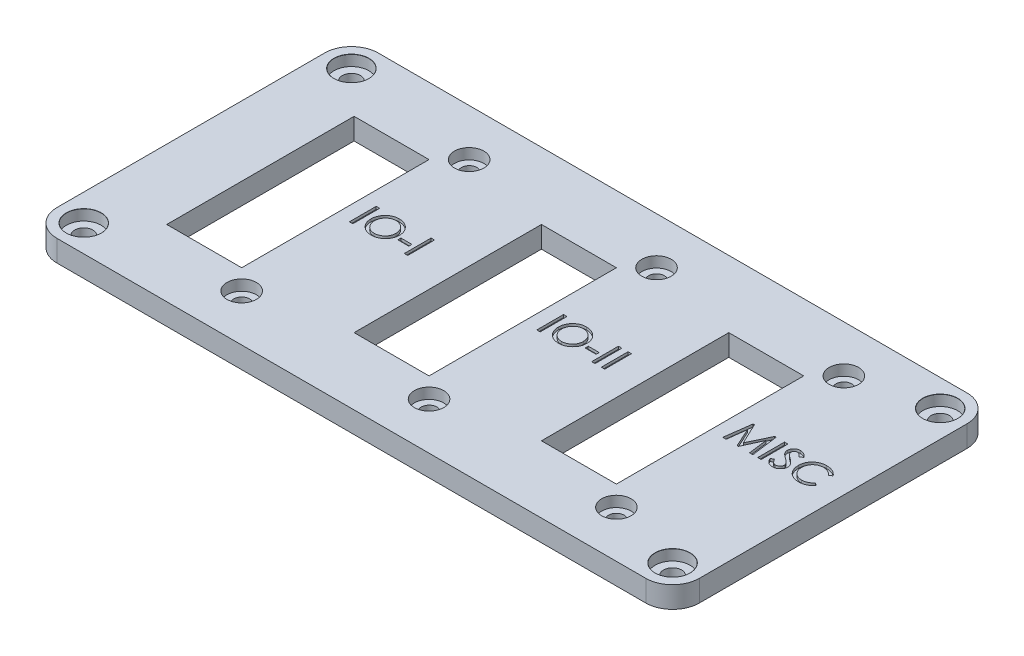
from build123d import *

# Parameters (mm, degrees)
SKETCH1_W                            = 120
SKETCH1_H                            = 60
BODY_DEPTH                           = 4
EDGE_FILLETS_R                       = 5
SKETCH4_W                            = 14
SKETCH4_H                            = 35
CONNECTOR_CUTOUT_DEPTH               = 68.201190466
CONNECTOR_MOUNTING_HOLES_START       = 2
CONNECTOR_MOUNTING_HOLES_OUTLINE_R   = 2.75
CONNECTOR_MOUNTING_HOLES_DEPTH       = 2
CONNECTOR_MOUNTING_HOLES_2_OUTLINE_R = 1.45
CONNECTOR_MOUNTING_HOLES_2_DEPTH     = 2
CONNECTOR_PATTERN_COUNT              = 3
CONNECTOR_PATTERN_PITCH              = 35
DESIGN_SKETCH_W                      = 0.641025641
DESIGN_SKETCH_H                      = 5
DESIGN_SKETCH_W_2                    = 2.051282051
DESIGN_SKETCH_H_2                    = 0.576923076
DESIGN_SKETCH_W_3                    = 0.641025642
DESIGN_CUTOUT_DEPTH                  = 0.5


# Read off the part's stored shape, not the designer's step: mounting_holes, connector_mounting_holes
with BuildPart() as part:
    # Sketch1 → body (new body)
    with BuildSketch(Plane(origin=(0, 0, 0), x_dir=(1, 0, 0), z_dir=(0, 1, 0))):
        Rectangle(SKETCH1_W, SKETCH1_H)
    extrude(amount=BODY_DEPTH)

    # mounting_holes outline → mounting_holes (revolve, cut)
    with BuildSketch(Plane(origin=(55, 0, 25), x_dir=(1, 0, 0), z_dir=(0, 0, 1))):
        Polygon((0, 0), (1.7, 0), (1.7, 2), (3.25, 2), (3.25, 3.975), (3.275, 4), (0, 4), align=None)
    revolve(axis=Axis((55, 0, 25), (0, 1, 0)), mode=Mode.SUBTRACT)

    # mounting_holes 2 outline → mounting_holes 2 (revolve, cut)
    with BuildSketch(Plane(origin=(-55, 0, -25), x_dir=(1, 0, 0), z_dir=(0, 0, 1))):
        Polygon((0, 4), (0, 0), (1.7, 0), (1.7, 2), (3.25, 2), (3.25, 3.975), (3.275, 4), align=None)
    revolve(axis=Axis((-55, 0, -25), (0, 1, 0)), mode=Mode.SUBTRACT)

    # mounting_holes 3 outline → mounting_holes 3 (revolve, cut)
    with BuildSketch(Plane(origin=(55, 0, -25), x_dir=(1, 0, 0), z_dir=(0, 0, 1))):
        Polygon((0, 4), (0, 0), (1.7, 0), (1.7, 2), (3.25, 2), (3.25, 3.975), (3.275, 4), align=None)
    revolve(axis=Axis((55, 0, -25), (0, 1, 0)), mode=Mode.SUBTRACT)

    # mounting_holes 4 outline → mounting_holes 4 (revolve, cut)
    with BuildSketch(Plane(origin=(-55, 0, 25), x_dir=(1, 0, 0), z_dir=(0, 0, 1))):
        Polygon((0, 4), (0, 0), (1.7, 0), (1.7, 2), (3.25, 2), (3.25, 3.975), (3.275, 4), align=None)
    revolve(axis=Axis((-55, 0, 25), (0, 1, 0)), mode=Mode.SUBTRACT)

    # edge_fillets
    edge_fillets_edges = [part.edges().sort_by_distance(p)[0] for p in [
        (60, 2, 30),
        (-60, 2, 30),
        (-60, 2, -30),
        (60, 2, -30),
    ]]
    fillet(edge_fillets_edges, radius=EDGE_FILLETS_R)

    # Sketch4 → connector_cutout (cut, through all)
    with BuildSketch(Plane.XZ):
        with Locations((-40, 0)):
            Rectangle(SKETCH4_W, SKETCH4_H)
    connector_cutout = extrude(amount=-CONNECTOR_CUTOUT_DEPTH, mode=Mode.SUBTRACT)

    # connector_mounting_holes outline → connector_mounting_holes (cut)
    with BuildSketch(Plane(origin=(0, 0, 0), x_dir=(1, 0, 0), z_dir=(0, 1, 0)).offset(CONNECTOR_MOUNTING_HOLES_START)):
        with Locations((-29.25, 21.25)):
            Circle(CONNECTOR_MOUNTING_HOLES_OUTLINE_R)
        with Locations((-29.25, -21.25)):
            Circle(CONNECTOR_MOUNTING_HOLES_OUTLINE_R)
    connector_mounting_holes = extrude(amount=CONNECTOR_MOUNTING_HOLES_DEPTH, mode=Mode.SUBTRACT)

    # connector_mounting_holes 2 outline → connector_mounting_holes 2 (cut)
    with BuildSketch(Plane(origin=(0, 0, 0), x_dir=(1, 0, 0), z_dir=(0, 1, 0))):
        with Locations((-29.25, 21.25)):
            Circle(CONNECTOR_MOUNTING_HOLES_2_OUTLINE_R)
        with Locations((-29.25, -21.25)):
            Circle(CONNECTOR_MOUNTING_HOLES_2_OUTLINE_R)
    connector_mounting_holes_2 = extrude(amount=CONNECTOR_MOUNTING_HOLES_2_DEPTH, mode=Mode.SUBTRACT)

    # connector_pattern: connector_cutout, connector_mounting_holes, connector_mounting_holes 2 ×3
    with Locations(*[(i * CONNECTOR_PATTERN_PITCH, 0, 0) for i in range(1, CONNECTOR_PATTERN_COUNT)]):
        add(connector_cutout, mode=Mode.SUBTRACT)
        add(connector_mounting_holes, mode=Mode.SUBTRACT)
        add(connector_mounting_holes_2, mode=Mode.SUBTRACT)

    # design_sketch → design-cutout (cut)
    # profile 1 of 13: a face of its own
    with BuildSketch(Plane(origin=(0, 4, 0), x_dir=(1, 0, 0), z_dir=(0, 1, 0))):
        with Locations((-30.051282052, 2.5)):
            Rectangle(DESIGN_SKETCH_W, DESIGN_SKETCH_H)
    # profile 2 of 13: a face of its own
    with BuildSketch(Plane(origin=(0, 4, 0), x_dir=(1, 0, 0), z_dir=(0, 1, 0))):
        with BuildLine():
            add(Edge.make_bspline(
                [(-26.236177885, 5.128205128), (-26.14023907, 5.125990241), (-25.951669411, 5.121636835), (-25.675038914, 5.084519537), (-25.410865504, 5.025139559), (-25.159538839, 4.94032377), (-24.920889243, 4.83164906), (-24.694540217, 4.698906573), (-24.481163918, 4.541694182), (-24.28336914, 4.362027206), (-24.103697083, 4.166315593), (-23.944469138, 3.959435655), (-23.81224827, 3.740471418), (-23.701718243, 3.512591424), (-23.618084354, 3.273681613), (-23.556120603, 3.025766171), (-23.519575928, 2.767184246), (-23.515094325, 2.591260773), (-23.512820513, 2.502003205)],
                knots=[0, 0, 0, 0, 1.090651108, 2.14369656, 3.167927427, 4.165692988, 5.154576575, 6.145033357, 7.14440862, 8.163220312, 9.178978109, 10.162394332, 11.12677451, 12.082874982, 13.037579715, 13.999894772, 14.985214855, 16, 16, 16, 16], degree=3))
            add(Edge.make_bspline(
                [(-23.512820513, 2.502003205), (-23.515050606, 2.413402109), (-23.519445699, 2.238786063), (-23.556692547, 1.981779842), (-23.616740577, 1.734164805), (-23.700833339, 1.495458754), (-23.811147142, 1.267482456), (-23.944029295, 1.048323208), (-24.102299261, 0.84007439), (-24.281300859, 0.642992783), (-24.478011518, 0.462680769), (-24.689226614, 0.304326422), (-24.9123841, 0.171042552), (-25.146372279, 0.060089835), (-25.393105271, -0.023210174), (-25.650740799, -0.084980617), (-25.920292995, -0.121476231), (-26.103855996, -0.125938213), (-26.197115385, -0.128205128)],
                knots=[0, 0, 0, 0, 1.015667565, 2.001689161, 2.971180881, 3.933912672, 4.898051938, 5.870540525, 6.8683264, 7.892867857, 8.919988739, 9.923897136, 10.914753654, 11.896185405, 12.887840524, 13.895451133, 14.930781579, 16, 16, 16, 16], degree=3))
            add(Edge.make_bspline(
                [(-26.197115385, -0.128205128), (-26.288057005, -0.126006755), (-26.467003041, -0.121681012), (-26.729519745, -0.08421039), (-26.981382563, -0.025796295), (-27.222266073, 0.058155846), (-27.452552891, 0.165235279), (-27.670931008, 0.298064805), (-27.879329975, 0.452770383), (-28.073785775, 0.629999269), (-28.251253089, 0.824075404), (-28.406918911, 1.030662067), (-28.539313571, 1.247131224), (-28.647014307, 1.473730472), (-28.730916628, 1.71067502), (-28.789120359, 1.957907915), (-28.826799973, 2.214724483), (-28.83113415, 2.389355866), (-28.833333333, 2.477964744)],
                knots=[0, 0, 0, 0, 1.056734814, 2.079339537, 3.076314658, 4.058285941, 5.039336339, 6.023146808, 7.024524339, 8.052147497, 9.076900738, 10.077495695, 11.054668894, 12.021676166, 12.988994953, 13.970866516, 14.970407042, 16, 16, 16, 16], degree=3))
            add(Edge.make_bspline(
                [(-28.833333333, 2.477964744), (-28.832570271, 2.537440259), (-28.831053774, 2.65564098), (-28.812769582, 2.831160665), (-28.78629164, 3.003876706), (-28.748145315, 3.173207847), (-28.698942628, 3.339184222), (-28.638298184, 3.501457135), (-28.568838377, 3.661398116), (-28.485989467, 3.815832357), (-28.396038752, 3.96565673), (-28.296083947, 4.106847244), (-28.190353892, 4.241123158), (-28.074396973, 4.364899994), (-27.952090221, 4.481806442), (-27.821434735, 4.590038566), (-27.683231707, 4.690574299), (-27.536885402, 4.781174762), (-27.386002165, 4.86311639), (-27.230463908, 4.933433318), (-27.072383092, 4.993784835), (-26.911019309, 5.042700299), (-26.746801064, 5.081317493), (-26.579369943, 5.107613713), (-26.408859334, 5.125934167), (-26.293986021, 5.127444884), (-26.236177885, 5.128205128)],
                knots=[0, 0, 0, 0, 1.036913812, 2.060746492, 3.074578145, 4.08324605, 5.085523353, 6.091481477, 7.103103322, 8.124200051, 9.145827961, 10.149052085, 11.139400635, 12.124186929, 13.104469564, 14.088618662, 15.081002312, 16.082788945, 17.088477375, 18.073521874, 19.057670972, 20.037642247, 21.012252997, 21.997331918, 22.992189685, 24, 24, 24, 24], degree=3))
        make_face()
        with BuildLine():
            add(Edge.make_bspline(
                [(-26.215144231, 4.551282051), (-26.257248793, 4.550615557), (-26.340995705, 4.549289885), (-26.465756251, 4.535413503), (-26.589224881, 4.514569173), (-26.711615453, 4.485253849), (-26.833028877, 4.448623742), (-26.952420124, 4.401763555), (-27.070942759, 4.348147409), (-27.186482655, 4.284592136), (-27.299114772, 4.215603036), (-27.40564823, 4.138585871), (-27.507305701, 4.056719764), (-27.602622235, 3.967246647), (-27.69141888, 3.8713379), (-27.77418874, 3.769151274), (-27.851563565, 3.661040207), (-27.921848967, 3.546255336), (-27.986765441, 3.427172316), (-28.041410469, 3.303020221), (-28.087698857, 3.175120007), (-28.125689225, 3.043606338), (-28.156127203, 2.908219047), (-28.176491904, 2.768907943), (-28.190412283, 2.625817045), (-28.191669436, 2.529080893), (-28.192307692, 2.479967949)],
                knots=[0, 0, 0, 0, 0.951425037, 1.892405618, 2.834142553, 3.780555396, 4.735506122, 5.698386817, 6.677778342, 7.674036042, 8.677244726, 9.661625187, 10.643485342, 11.625954439, 12.613944774, 13.595804929, 14.596853729, 15.616869823, 16.636634596, 17.660413109, 18.67984269, 19.709280547, 20.753005387, 21.813969624, 22.890152378, 24, 24, 24, 24], degree=3))
            add(Edge.make_bspline(
                [(-28.192307692, 2.479967949), (-28.190757273, 2.408418164), (-28.187716345, 2.268083377), (-28.158389548, 2.06223947), (-28.112922924, 1.865540705), (-28.048567033, 1.67818616), (-27.965701988, 1.500232527), (-27.864281464, 1.331731213), (-27.744135446, 1.172259987), (-27.606697296, 1.02488331), (-27.457700576, 0.890221956), (-27.299659493, 0.772879579), (-27.136192324, 0.671411063), (-26.964675691, 0.590080936), (-26.786790789, 0.526699088), (-26.602235629, 0.481598503), (-26.410976124, 0.453713395), (-26.281011225, 0.45039814), (-26.215144231, 0.448717949)],
                knots=[0, 0, 0, 0, 1.087324682, 2.132633634, 3.154656843, 4.153212625, 5.138884617, 6.133989092, 7.13811672, 8.169089965, 9.193543553, 10.187520856, 11.158295186, 12.114249704, 13.068004623, 14.02467326, 14.998892505, 16, 16, 16, 16], degree=3))
            add(Edge.make_bspline(
                [(-26.215144231, 0.448717949), (-26.168370636, 0.449386199), (-26.075638888, 0.45071105), (-25.938174317, 0.464393853), (-25.803429668, 0.485490906), (-25.671325548, 0.513891061), (-25.542255255, 0.553060565), (-25.415244786, 0.598122565), (-25.291688285, 0.654319682), (-25.170698148, 0.716489936), (-25.055363133, 0.78798893), (-24.94438345, 0.863997292), (-24.840001811, 0.946700665), (-24.744220242, 1.037752512), (-24.653133923, 1.13302819), (-24.569215203, 1.235200968), (-24.491877223, 1.343603813), (-24.421895697, 1.457889591), (-24.359124848, 1.576689326), (-24.303332434, 1.699121906), (-24.257984844, 1.825367935), (-24.219071979, 1.954192562), (-24.190381243, 2.086910526), (-24.169635636, 2.222718844), (-24.155786022, 2.361827432), (-24.154498047, 2.455562132), (-24.153846154, 2.503004808)],
                knots=[0, 0, 0, 0, 1.036970321, 2.055862331, 3.060095599, 4.060719653, 5.049301004, 6.049377071, 7.046955997, 8.056986028, 9.063944937, 10.053856218, 11.039021426, 12.013303897, 12.982198174, 13.960523328, 14.942567566, 15.933032457, 16.929951754, 17.920776327, 18.913894254, 19.902475604, 20.903099658, 21.921964767, 22.948227815, 24, 24, 24, 24], degree=3))
            add(Edge.make_bspline(
                [(-24.153846154, 2.503004808), (-24.154501034, 2.550113535), (-24.155794817, 2.643181691), (-24.16956606, 2.780966519), (-24.190356937, 2.915112771), (-24.21924939, 3.046107093), (-24.257787848, 3.173375568), (-24.303368794, 3.297892257), (-24.359127663, 3.418332481), (-24.421934128, 3.535110393), (-24.492051702, 3.647879114), (-24.570286862, 3.754523201), (-24.654489698, 3.856276049), (-24.745907385, 3.95163833), (-24.844600214, 4.04095755), (-24.949630932, 4.124902702), (-25.061315679, 4.203797288), (-25.179930543, 4.274847113), (-25.3023081, 4.340129952), (-25.427797347, 4.395802412), (-25.554227936, 4.44452681), (-25.68276561, 4.483670095), (-25.813386021, 4.513515855), (-25.945764851, 4.535782997), (-26.079982645, 4.549168361), (-26.17004249, 4.550576739), (-26.215144231, 4.551282051)],
                knots=[0, 0, 0, 0, 1.048789873, 2.071992723, 3.080474812, 4.070813472, 5.056451928, 6.039816187, 7.021295338, 8.009314668, 8.991328769, 9.975844821, 10.952581135, 11.930703152, 12.91499457, 13.914777939, 14.923479275, 15.957618598, 16.991998452, 18.010408503, 19.012925223, 20.00783076, 20.999814803, 21.994803685, 22.995802798, 24, 24, 24, 24], degree=3))
        make_face(mode=Mode.SUBTRACT)
    # profile 3 of 13: a face of its own
    with BuildSketch(Plane(origin=(0, 4, 0), x_dir=(1, 0, 0), z_dir=(0, 1, 0))):
        with Locations((-21.910256411, 1.891025641)):
            Rectangle(DESIGN_SKETCH_W_2, DESIGN_SKETCH_H_2)
    # profile 4 of 13: a face of its own
    with BuildSketch(Plane(origin=(0, 4, 0), x_dir=(1, 0, 0), z_dir=(0, 1, 0))):
        with Locations((-19.794871795, 2.5)):
            Rectangle(DESIGN_SKETCH_W, DESIGN_SKETCH_H)
    # profile 5 of 13: a face of its own
    with BuildSketch(Plane(origin=(0, 4, 0), x_dir=(1, 0, 0), z_dir=(0, 1, 0))):
        with Locations((4.948717949, 2.5)):
            Rectangle(DESIGN_SKETCH_W, DESIGN_SKETCH_H)
    # profile 6 of 13: a face of its own
    with BuildSketch(Plane(origin=(0, 4, 0), x_dir=(1, 0, 0), z_dir=(0, 1, 0))):
        with BuildLine():
            add(Edge.make_bspline(
                [(8.763822115, 5.128205128), (8.85976093, 5.125990241), (9.048330589, 5.121636835), (9.324961086, 5.084519537), (9.589134496, 5.025139559), (9.840461161, 4.94032377), (10.079110757, 4.83164906), (10.305459783, 4.698906573), (10.518836082, 4.541694182), (10.71663086, 4.362027206), (10.896302917, 4.166315593), (11.055530862, 3.959435655), (11.18775173, 3.740471418), (11.298281757, 3.512591424), (11.381915646, 3.273681613), (11.443879397, 3.025766171), (11.480424072, 2.767184246), (11.484905675, 2.591260773), (11.487179487, 2.502003205)],
                knots=[0, 0, 0, 0, 1.090651108, 2.14369656, 3.167927427, 4.165692988, 5.154576575, 6.145033357, 7.14440862, 8.163220312, 9.178978109, 10.162394332, 11.12677451, 12.082874982, 13.037579715, 13.999894772, 14.985214855, 16, 16, 16, 16], degree=3))
            add(Edge.make_bspline(
                [(11.487179487, 2.502003205), (11.484949394, 2.413402109), (11.480554301, 2.238786063), (11.443307453, 1.981779842), (11.383259423, 1.734164805), (11.299166661, 1.495458754), (11.188852858, 1.267482456), (11.055970705, 1.048323208), (10.897700739, 0.84007439), (10.718699141, 0.642992783), (10.521988482, 0.462680769), (10.310773386, 0.304326422), (10.0876159, 0.171042552), (9.853627721, 0.060089835), (9.606894729, -0.023210174), (9.349259201, -0.084980617), (9.079707005, -0.121476231), (8.896144004, -0.125938213), (8.802884615, -0.128205128)],
                knots=[0, 0, 0, 0, 1.015667565, 2.001689161, 2.971180881, 3.933912672, 4.898051938, 5.870540525, 6.8683264, 7.892867857, 8.919988739, 9.923897136, 10.914753654, 11.896185405, 12.887840524, 13.895451133, 14.930781579, 16, 16, 16, 16], degree=3))
            add(Edge.make_bspline(
                [(8.802884615, -0.128205128), (8.711942995, -0.126006755), (8.532996959, -0.121681012), (8.270480255, -0.08421039), (8.018617437, -0.025796295), (7.777733927, 0.058155846), (7.547447109, 0.165235279), (7.329068992, 0.298064805), (7.120670025, 0.452770383), (6.926214225, 0.629999269), (6.748746911, 0.824075404), (6.593081089, 1.030662067), (6.460686429, 1.247131224), (6.352985693, 1.473730472), (6.269083372, 1.71067502), (6.210879641, 1.957907915), (6.173200027, 2.214724483), (6.16886585, 2.389355866), (6.166666667, 2.477964744)],
                knots=[0, 0, 0, 0, 1.056734814, 2.079339537, 3.076314658, 4.058285941, 5.039336339, 6.023146808, 7.024524339, 8.052147497, 9.076900738, 10.077495695, 11.054668894, 12.021676166, 12.988994953, 13.970866516, 14.970407042, 16, 16, 16, 16], degree=3))
            add(Edge.make_bspline(
                [(6.166666667, 2.477964744), (6.167429729, 2.537440259), (6.168946226, 2.65564098), (6.187230418, 2.831160665), (6.21370836, 3.003876706), (6.251854685, 3.173207847), (6.301057372, 3.339184222), (6.361701816, 3.501457135), (6.431161623, 3.661398116), (6.514010533, 3.815832357), (6.603961248, 3.96565673), (6.703916053, 4.106847244), (6.809646108, 4.241123158), (6.925603027, 4.364899994), (7.047909779, 4.481806442), (7.178565265, 4.590038566), (7.316768293, 4.690574299), (7.463114598, 4.781174762), (7.613997835, 4.86311639), (7.769536092, 4.933433318), (7.927616908, 4.993784835), (8.088980691, 5.042700299), (8.253198936, 5.081317493), (8.420630057, 5.107613713), (8.591140666, 5.125934167), (8.706013979, 5.127444884), (8.763822115, 5.128205128)],
                knots=[0, 0, 0, 0, 1.036913812, 2.060746492, 3.074578145, 4.08324605, 5.085523353, 6.091481477, 7.103103322, 8.124200051, 9.145827961, 10.149052085, 11.139400635, 12.124186929, 13.104469564, 14.088618662, 15.081002312, 16.082788945, 17.088477375, 18.073521874, 19.057670972, 20.037642247, 21.012252997, 21.997331918, 22.992189685, 24, 24, 24, 24], degree=3))
        make_face()
        with BuildLine():
            add(Edge.make_bspline(
                [(8.784855769, 4.551282051), (8.742751207, 4.550615557), (8.659004295, 4.549289885), (8.534243749, 4.535413503), (8.410775119, 4.514569173), (8.288384547, 4.485253849), (8.166971123, 4.448623742), (8.047579876, 4.401763555), (7.929057241, 4.348147409), (7.813517345, 4.284592136), (7.700885228, 4.215603036), (7.59435177, 4.138585871), (7.492694299, 4.056719764), (7.397377765, 3.967246647), (7.30858112, 3.8713379), (7.22581126, 3.769151274), (7.148436435, 3.661040207), (7.078151033, 3.546255336), (7.013234559, 3.427172316), (6.958589531, 3.303020221), (6.912301143, 3.175120007), (6.874310775, 3.043606338), (6.843872797, 2.908219047), (6.823508096, 2.768907943), (6.809587717, 2.625817045), (6.808330564, 2.529080893), (6.807692308, 2.479967949)],
                knots=[0, 0, 0, 0, 0.951425037, 1.892405618, 2.834142553, 3.780555396, 4.735506122, 5.698386817, 6.677778342, 7.674036042, 8.677244726, 9.661625187, 10.643485342, 11.625954439, 12.613944774, 13.595804929, 14.596853729, 15.616869823, 16.636634596, 17.660413109, 18.67984269, 19.709280547, 20.753005387, 21.813969624, 22.890152378, 24, 24, 24, 24], degree=3))
            add(Edge.make_bspline(
                [(6.807692308, 2.479967949), (6.809242727, 2.408418164), (6.812283655, 2.268083377), (6.841610452, 2.06223947), (6.887077076, 1.865540705), (6.951432967, 1.67818616), (7.034298012, 1.500232527), (7.135718536, 1.331731213), (7.255864554, 1.172259987), (7.393302704, 1.02488331), (7.542299424, 0.890221956), (7.700340507, 0.772879579), (7.863807676, 0.671411063), (8.035324309, 0.590080936), (8.213209211, 0.526699088), (8.397764371, 0.481598503), (8.589023876, 0.453713395), (8.718988775, 0.45039814), (8.784855769, 0.448717949)],
                knots=[0, 0, 0, 0, 1.087324682, 2.132633634, 3.154656843, 4.153212625, 5.138884617, 6.133989092, 7.13811672, 8.169089965, 9.193543553, 10.187520856, 11.158295186, 12.114249704, 13.068004623, 14.02467326, 14.998892505, 16, 16, 16, 16], degree=3))
            add(Edge.make_bspline(
                [(8.784855769, 0.448717949), (8.831629364, 0.449386199), (8.924361112, 0.45071105), (9.061825683, 0.464393853), (9.196570332, 0.485490906), (9.328674452, 0.513891061), (9.457744745, 0.553060565), (9.584755214, 0.598122565), (9.708311715, 0.654319682), (9.829301852, 0.716489936), (9.944636867, 0.78798893), (10.05561655, 0.863997292), (10.159998189, 0.946700665), (10.255779758, 1.037752512), (10.346866077, 1.13302819), (10.430784797, 1.235200968), (10.508122777, 1.343603813), (10.578104303, 1.457889591), (10.640875152, 1.576689326), (10.696667566, 1.699121906), (10.742015156, 1.825367935), (10.780928021, 1.954192562), (10.809618757, 2.086910526), (10.830364364, 2.222718844), (10.844213978, 2.361827432), (10.845501953, 2.455562132), (10.846153846, 2.503004808)],
                knots=[0, 0, 0, 0, 1.036970321, 2.055862331, 3.060095599, 4.060719653, 5.049301004, 6.049377071, 7.046955997, 8.056986028, 9.063944937, 10.053856218, 11.039021426, 12.013303897, 12.982198174, 13.960523328, 14.942567566, 15.933032457, 16.929951754, 17.920776327, 18.913894254, 19.902475604, 20.903099658, 21.921964767, 22.948227815, 24, 24, 24, 24], degree=3))
            add(Edge.make_bspline(
                [(10.846153846, 2.503004808), (10.845498966, 2.550113535), (10.844205183, 2.643181691), (10.83043394, 2.780966519), (10.809643063, 2.915112771), (10.78075061, 3.046107093), (10.742212152, 3.173375568), (10.696631206, 3.297892257), (10.640872337, 3.418332481), (10.578065872, 3.535110393), (10.507948298, 3.647879114), (10.429713138, 3.754523201), (10.345510302, 3.856276049), (10.254092615, 3.95163833), (10.155399786, 4.04095755), (10.050369068, 4.124902702), (9.938684321, 4.203797288), (9.820069457, 4.274847113), (9.6976919, 4.340129952), (9.572202653, 4.395802412), (9.445772064, 4.44452681), (9.31723439, 4.483670095), (9.186613979, 4.513515855), (9.054235149, 4.535782997), (8.920017355, 4.549168361), (8.82995751, 4.550576739), (8.784855769, 4.551282051)],
                knots=[0, 0, 0, 0, 1.048789873, 2.071992723, 3.080474812, 4.070813472, 5.056451928, 6.039816187, 7.021295338, 8.009314668, 8.991328769, 9.975844821, 10.952581135, 11.930703152, 12.91499457, 13.914777939, 14.923479275, 15.957618598, 16.991998452, 18.010408503, 19.012925223, 20.00783076, 20.999814803, 21.994803685, 22.995802798, 24, 24, 24, 24], degree=3))
        make_face(mode=Mode.SUBTRACT)
    # profile 7 of 13: a face of its own
    with BuildSketch(Plane(origin=(0, 4, 0), x_dir=(1, 0, 0), z_dir=(0, 1, 0))):
        with Locations((13.08974359, 1.891025641)):
            Rectangle(DESIGN_SKETCH_W_2, DESIGN_SKETCH_H_2)
    # profile 8 of 13: a face of its own
    with BuildSketch(Plane(origin=(0, 4, 0), x_dir=(1, 0, 0), z_dir=(0, 1, 0))):
        with Locations((15.205128206, 2.5)):
            Rectangle(DESIGN_SKETCH_W, DESIGN_SKETCH_H)
    # profile 9 of 13: a face of its own
    with BuildSketch(Plane(origin=(0, 4, 0), x_dir=(1, 0, 0), z_dir=(0, 1, 0))):
        with Locations((17, 2.5)):
            Rectangle(DESIGN_SKETCH_W_3, DESIGN_SKETCH_H)
    # profile 10 of 13: a face of its own
    with BuildSketch(Plane(origin=(0, 4, 0), x_dir=(1, 0, 0), z_dir=(0, 1, 0))):
        Polygon((39.371794872, 0), (40.039863782, 5), (40.292267628, 5), (42.188301282, 1.025641026), (44.083333333, 5), (44.33974359, 5), (45.012820513, 0), (44.379807692, 0), (43.932091346, 3.525641026), (42.310496795, 0), (42.067107372, 0), (40.449519231, 3.525641026), (40.006810897, 0), align=None)
    # profile 11 of 13: a face of its own
    with BuildSketch(Plane(origin=(0, 4, 0), x_dir=(1, 0, 0), z_dir=(0, 1, 0))):
        with Locations((46.230769231, 2.5)):
            Rectangle(DESIGN_SKETCH_W, DESIGN_SKETCH_H)
    # profile 12 of 13: a face of its own
    with BuildSketch(Plane(origin=(0, 4, 0), x_dir=(1, 0, 0), z_dir=(0, 1, 0))):
        with BuildLine():
            Line((47.192307692, 0.991586538), (47.737179487, 1.282051282))
            add(Edge.make_bspline(
                [(47.737179487, 1.282051282), (47.776887361, 1.216278253), (47.852780107, 1.090567773), (47.977399848, 0.921220831), (48.101305624, 0.776812397), (48.225720532, 0.657488278), (48.35237279, 0.565165172), (48.479969419, 0.498441335), (48.60930902, 0.456503185), (48.6967597, 0.451285127), (48.739783654, 0.448717949)],
                knots=[0, 0, 0, 0, 1.354943589, 2.589672558, 3.704607527, 4.708856974, 5.624398268, 6.459549776, 7.242129862, 8, 8, 8, 8], degree=3))
            add(Edge.make_bspline(
                [(48.739783654, 0.448717949), (48.77994883, 0.450009025), (48.859504489, 0.452566275), (48.976396022, 0.474743935), (49.089577977, 0.50853487), (49.19708912, 0.556652412), (49.296414647, 0.615602302), (49.384097254, 0.685720667), (49.458493502, 0.76510499), (49.519813257, 0.852678368), (49.567879339, 0.946180069), (49.603263354, 1.042956909), (49.62403024, 1.143287737), (49.626803353, 1.210843417), (49.628205128, 1.244991987)],
                knots=[0, 0, 0, 0, 1.0888553, 2.156709112, 3.216967111, 4.287545289, 5.343926646, 6.34269433, 7.323221176, 8.28571565, 9.233736345, 10.167849744, 11.073870434, 12, 12, 12, 12], degree=3))
            add(Edge.make_bspline(
                [(49.628205128, 1.244991987), (49.62624111, 1.283910579), (49.622272279, 1.362556151), (49.590417479, 1.479385088), (49.538647616, 1.595070908), (49.490759326, 1.667300865), (49.465945513, 1.704727564)],
                knots=[0, 0, 0, 0, 0.941861274, 1.903286225, 2.913566088, 4, 4, 4, 4], degree=3))
            add(Edge.make_bspline(
                [(49.465945513, 1.704727564), (49.444488914, 1.731971484), (49.399320952, 1.789322248), (49.322864403, 1.875664715), (49.233400206, 1.965732718), (49.131073487, 2.059119929), (49.017682839, 2.157918875), (48.891302139, 2.259576046), (48.752824808, 2.365809467), (48.655783739, 2.437079153), (48.60556891, 2.473958333)],
                knots=[0, 0, 0, 0, 0.718593868, 1.512701116, 2.388487339, 3.348232282, 4.383172848, 5.504845107, 6.708858268, 8, 8, 8, 8], degree=3))
            add(Edge.make_bspline(
                [(48.60556891, 2.473958333), (48.554362929, 2.511183426), (48.45611299, 2.582607956), (48.317687404, 2.687316647), (48.193575394, 2.783863863), (48.084728699, 2.872325064), (47.991134948, 2.953469116), (47.912991303, 3.02696305), (47.847945316, 3.090789999), (47.812991458, 3.133735765), (47.797275641, 3.153044872)],
                knots=[0, 0, 0, 0, 1.435833971, 2.754963323, 3.936484598, 5.002077172, 5.935979083, 6.744956812, 7.435712417, 8, 8, 8, 8], degree=3))
            add(Edge.make_bspline(
                [(47.797275641, 3.153044872), (47.774332673, 3.18268942), (47.729259366, 3.240928519), (47.672194999, 3.334347806), (47.623092389, 3.428989733), (47.582649109, 3.525730627), (47.551308002, 3.624261432), (47.529746803, 3.72492769), (47.514537908, 3.827329533), (47.51339504, 3.896511735), (47.512820513, 3.931290064)],
                knots=[0, 0, 0, 0, 1.064105702, 2.090521257, 3.104283852, 4.09061442, 5.065433238, 6.036507983, 7.012940167, 8, 8, 8, 8], degree=3))
            add(Edge.make_bspline(
                [(47.512820513, 3.931290064), (47.514629768, 3.985526289), (47.51821196, 4.092910046), (47.55022378, 4.249674244), (47.602099487, 4.399042527), (47.672909274, 4.540242896), (47.763332083, 4.670647035), (47.870886339, 4.787679611), (47.996153986, 4.888843371), (48.135792668, 4.974084547), (48.286306705, 5.043215707), (48.444833259, 5.092489233), (48.609450548, 5.122360588), (48.721297263, 5.126242512), (48.777844551, 5.128205128)],
                knots=[0, 0, 0, 0, 1.004530234, 1.988896367, 2.951881425, 3.928924249, 4.907494835, 5.884204368, 6.865296418, 7.88218147, 8.909671266, 9.927572845, 10.952225504, 12, 12, 12, 12], degree=3))
            add(Edge.make_bspline(
                [(48.777844551, 5.128205128), (48.84205077, 5.125906957), (48.969211496, 5.121355417), (49.156658361, 5.090510369), (49.335903617, 5.034975978), (49.480265888, 4.973676324), (49.592408966, 4.911002253), (49.67722507, 4.854396838), (49.764157202, 4.790335624), (49.850451963, 4.715625207), (49.939472657, 4.633880358), (50.026660706, 4.540657616), (50.117533783, 4.441299692), (50.175452956, 4.369645277), (50.205128205, 4.332932692)],
                knots=[0, 0, 0, 0, 1.360590218, 2.69465552, 4.010645498, 5.328858611, 6.009843139, 6.729980544, 7.488405022, 8.296451933, 9.147430815, 10.048128915, 10.999946711, 12, 12, 12, 12], degree=3))
            Line((50.205128205, 4.332932692), (49.682291667, 3.974358974))
            add(Edge.make_bspline(
                [(49.682291667, 3.974358974), (49.655006244, 4.003492421), (49.602543223, 4.059508728), (49.52537121, 4.138948411), (49.452355962, 4.210239848), (49.383275891, 4.273056905), (49.319679328, 4.328519844), (49.259779267, 4.374758443), (49.205448859, 4.414498418), (49.13753103, 4.453885119), (49.054268896, 4.49289312), (48.951792747, 4.527991374), (48.844299679, 4.546749233), (48.771565489, 4.549759448), (48.734775641, 4.551282051)],
                knots=[0, 0, 0, 0, 1.253377364, 2.409930098, 3.477532466, 4.457083962, 5.341772995, 6.126101147, 6.832963523, 7.453284126, 8.588253012, 9.715448048, 10.844445545, 12, 12, 12, 12], degree=3))
            add(Edge.make_bspline(
                [(48.734775641, 4.551282051), (48.695506407, 4.549446918), (48.619163808, 4.54587927), (48.50950167, 4.515328361), (48.408695654, 4.467120071), (48.319756485, 4.39889243), (48.245833031, 4.314444878), (48.191619047, 4.215525269), (48.15989153, 4.102793224), (48.155918149, 4.023645097), (48.153846154, 3.982371795)],
                knots=[0, 0, 0, 0, 1.033513523, 2.009234674, 2.977584268, 3.963375862, 4.942860848, 5.915719707, 6.913112236, 8, 8, 8, 8], degree=3))
            add(Edge.make_bspline(
                [(48.153846154, 3.982371795), (48.154653468, 3.955628024), (48.156266143, 3.90220517), (48.168111699, 3.823070732), (48.190008203, 3.746608092), (48.217755499, 3.671205601), (48.256592206, 3.597286928), (48.306053071, 3.52473535), (48.364767683, 3.45146066), (48.409828988, 3.40539666), (48.433293269, 3.381410256)],
                knots=[0, 0, 0, 0, 0.940834015, 1.879392378, 2.805520916, 3.734846727, 4.701501436, 5.734192883, 6.820151034, 8, 8, 8, 8], degree=3))
            add(Edge.make_bspline(
                [(48.433293269, 3.381410256), (48.445174234, 3.37023323), (48.472443539, 3.344579612), (48.522458374, 3.305296313), (48.583393654, 3.256045549), (48.656094159, 3.197631179), (48.742950446, 3.133224609), (48.84075113, 3.058522947), (48.951972534, 2.97688918), (49.030239348, 2.919658369), (49.071314103, 2.889623397)],
                knots=[0, 0, 0, 0, 0.485581606, 1.114511607, 1.892484918, 2.819534315, 3.891398566, 5.11240712, 6.484579029, 8, 8, 8, 8], degree=3))
            add(Edge.make_bspline(
                [(49.071314103, 2.889623397), (49.127273825, 2.848834488), (49.235529856, 2.769926922), (49.389311265, 2.650905244), (49.528000377, 2.534234723), (49.655103584, 2.423985722), (49.766322473, 2.315533513), (49.863740909, 2.211108003), (49.948582286, 2.111728466), (50.039193893, 1.985022335), (50.129787336, 1.828815444), (50.210796598, 1.640010067), (50.259137365, 1.449715237), (50.265895278, 1.322704499), (50.269230769, 1.260016026)],
                knots=[0, 0, 0, 0, 1.186540699, 2.295404303, 3.331123753, 4.291760032, 5.17774712, 5.991329992, 6.738459906, 7.414799035, 8.65800623, 9.82461674, 10.926299804, 12, 12, 12, 12], degree=3))
            add(Edge.make_bspline(
                [(50.269230769, 1.260016026), (50.26781153, 1.215539468), (50.264990683, 1.127138909), (50.244538764, 0.996433023), (50.210508571, 0.869391385), (50.161549973, 0.746550449), (50.100484189, 0.626757322), (50.024766703, 0.51105931), (49.934644312, 0.399902242), (49.833919131, 0.292614438), (49.722542513, 0.194012762), (49.603103734, 0.107230284), (49.47596745, 0.034732684), (49.342113361, -0.024086534), (49.202326859, -0.072016891), (49.055226531, -0.104845177), (48.901539918, -0.123794148), (48.796927445, -0.126719308), (48.743790064, -0.128205128)],
                knots=[0, 0, 0, 0, 0.932646097, 1.853705421, 2.767602683, 3.685675702, 4.622099834, 5.5835355, 6.579838097, 7.620108014, 8.666886363, 9.695041649, 10.711275682, 11.730160242, 12.757671447, 13.80585424, 14.885494678, 16, 16, 16, 16], degree=3))
            add(Edge.make_bspline(
                [(48.743790064, -0.128205128), (48.705041683, -0.127344477), (48.628723393, -0.125649351), (48.51542297, -0.11489686), (48.405167544, -0.094230681), (48.297352624, -0.067511393), (48.191910919, -0.033487987), (48.090201282, 0.010034186), (47.99053001, 0.060025417), (47.893468868, 0.11855997), (47.798894082, 0.187099323), (47.706268197, 0.26666003), (47.616129254, 0.358640672), (47.52693208, 0.461846225), (47.439855088, 0.577437539), (47.355101568, 0.704806797), (47.27158937, 0.843543269), (47.219255805, 0.941266126), (47.192307692, 0.991586538)],
                knots=[0, 0, 0, 0, 0.916943493, 1.805999526, 2.689245248, 3.568702553, 4.433092864, 5.307568578, 6.183755457, 7.069823058, 7.986358083, 8.944343836, 9.955449961, 11.030835633, 12.170024038, 13.377301724, 14.649494474, 16, 16, 16, 16], degree=3))
        make_face()
    # profile 13 of 13: a face of its own
    with BuildSketch(Plane(origin=(0, 4, 0), x_dir=(1, 0, 0), z_dir=(0, 1, 0))):
        with BuildLine():
            Line((55.91025641, 4.070512821), (55.399439103, 3.717948718))
            add(Edge.make_bspline(
                [(55.399439103, 3.717948718), (55.338257974, 3.784963556), (55.218488611, 3.916153101), (55.021258054, 4.088003312), (54.814848012, 4.232642209), (54.598967839, 4.349588251), (54.373388971, 4.441138474), (54.136924841, 4.504750574), (53.889328405, 4.543953276), (53.720566202, 4.548809016), (53.634615385, 4.551282051)],
                knots=[0, 0, 0, 0, 1.078723025, 2.111729107, 3.104379151, 4.071093171, 5.02612831, 5.993405043, 6.978038489, 8, 8, 8, 8], degree=3))
            add(Edge.make_bspline(
                [(53.634615385, 4.551282051), (53.58983891, 4.550636655), (53.500760608, 4.549352703), (53.368757055, 4.535236555), (53.23877259, 4.515915489), (53.110929513, 4.486559121), (52.985454935, 4.448181152), (52.861493933, 4.403674378), (52.740923749, 4.348548302), (52.622574758, 4.287276016), (52.508222684, 4.218358272), (52.400513187, 4.14181284), (52.29748664, 4.061060044), (52.202055769, 3.972281887), (52.113349692, 3.877036455), (52.029425277, 3.776522331), (51.952403713, 3.669432113), (51.882581044, 3.556086847), (51.818892092, 3.438175344), (51.765443391, 3.314833422), (51.719039801, 3.188153476), (51.680531076, 3.057475865), (51.652049761, 2.922404768), (51.630931263, 2.783307851), (51.617397846, 2.640493213), (51.616059489, 2.5437668), (51.615384615, 2.494991987)],
                knots=[0, 0, 0, 0, 1.002068956, 1.993515617, 2.969284448, 3.943018425, 4.926742606, 5.905741285, 6.889351865, 7.892340394, 8.888397413, 9.875523532, 10.849114049, 11.817064186, 12.790109362, 13.76151668, 14.746886598, 15.740472426, 16.740336546, 17.744438579, 18.747064952, 19.759451636, 20.791569268, 21.834966327, 22.908270136, 24, 24, 24, 24], degree=3))
            add(Edge.make_bspline(
                [(51.615384615, 2.494991987), (51.616929675, 2.421775483), (51.619954178, 2.278451952), (51.649187659, 2.068590246), (51.694802211, 1.86859935), (51.758922512, 1.678495058), (51.841773537, 1.49849333), (51.943134756, 1.328889887), (52.063589433, 1.169271187), (52.201140696, 1.02170042), (52.351084567, 0.886268531), (52.513596646, 0.770394513), (52.683111976, 0.669773198), (52.862980888, 0.589880805), (53.050661689, 0.52634121), (53.247606923, 0.481332206), (53.453204816, 0.45371617), (53.593462571, 0.450400915), (53.664663462, 0.448717949)],
                knots=[0, 0, 0, 0, 1.083728652, 2.12143175, 3.131304262, 4.117911469, 5.086904967, 6.060353746, 7.03835, 8.042493243, 9.043967071, 10.025107856, 10.993520914, 11.958418665, 12.934074928, 13.923564625, 14.94591178, 16, 16, 16, 16], degree=3))
            add(Edge.make_bspline(
                [(53.664663462, 0.448717949), (53.747287272, 0.451146699), (53.910474607, 0.455943638), (54.150421274, 0.496348461), (54.381615909, 0.561609386), (54.604308132, 0.653606938), (54.818679707, 0.771437162), (55.023723555, 0.916006046), (55.220582435, 1.08600633), (55.34023964, 1.21571001), (55.401442308, 1.282051282)],
                knots=[0, 0, 0, 0, 0.996377973, 1.967910503, 2.926842387, 3.889624876, 4.868586907, 5.872161968, 6.91164629, 8, 8, 8, 8], degree=3))
            Line((55.401442308, 1.282051282), (55.91025641, 0.931490385))
            add(Edge.make_bspline(
                [(55.91025641, 0.931490385), (55.877317966, 0.889718861), (55.81187356, 0.806724275), (55.70618574, 0.689331652), (55.595173939, 0.578924355), (55.477744977, 0.476526477), (55.354024489, 0.382237616), (55.224592162, 0.294966009), (55.089572373, 0.214850462), (54.949038887, 0.142748268), (54.803792311, 0.078215876), (54.653536098, 0.023872045), (54.499710302, -0.024068117), (54.340958573, -0.061599957), (54.17790064, -0.092018457), (54.010283963, -0.112435528), (53.838841457, -0.126254606), (53.723118208, -0.127550526), (53.664663462, -0.128205128)],
                knots=[0, 0, 0, 0, 0.990136069, 1.967271632, 2.938597646, 3.903378639, 4.8655934, 5.832714132, 6.808088679, 7.786607084, 8.77175572, 9.76479442, 10.759640537, 11.769709565, 12.799869661, 13.846050076, 14.911985293, 16, 16, 16, 16], degree=3))
            add(Edge.make_bspline(
                [(53.664663462, -0.128205128), (53.610886219, -0.127840678), (53.504881521, -0.127122281), (53.348222517, -0.115051883), (53.195714896, -0.098729905), (53.047769738, -0.074242974), (52.903688939, -0.044919522), (52.764648535, -0.006040118), (52.628762138, 0.037329212), (52.498006904, 0.089778356), (52.371396946, 0.14810438), (52.248486866, 0.212028688), (52.130485851, 0.284155187), (52.017295679, 0.363783345), (51.907584016, 0.448908581), (51.802460472, 0.541426238), (51.700831269, 0.640158179), (51.637973757, 0.711384347), (51.606370192, 0.747195513)],
                knots=[0, 0, 0, 0, 1.116169561, 2.200172621, 3.260333751, 4.299600589, 5.312386579, 6.311224183, 7.295427787, 8.272379731, 9.233840239, 10.188782295, 11.146938977, 12.102635432, 13.060741968, 14.028403985, 15.00871894, 16, 16, 16, 16], degree=3))
            add(Edge.make_bspline(
                [(51.606370192, 0.747195513), (51.555708505, 0.809372877), (51.455288613, 0.932618756), (51.32730186, 1.132948413), (51.216910006, 1.34145011), (51.129199305, 1.561094476), (51.059870996, 1.789291134), (51.009340295, 2.026736396), (50.980225174, 2.274242483), (50.97633622, 2.442498914), (50.974358974, 2.528044872)],
                knots=[0, 0, 0, 0, 0.995996121, 1.974230005, 2.94855815, 3.923972302, 4.908363682, 5.909282248, 6.937024559, 8, 8, 8, 8], degree=3))
            add(Edge.make_bspline(
                [(50.974358974, 2.528044872), (50.976591196, 2.617977097), (50.980982952, 2.794913136), (51.017969706, 3.054649255), (51.078235061, 3.303112069), (51.161068204, 3.541373751), (51.270830606, 3.767484966), (51.401728373, 3.984367531), (51.560028984, 4.187980369), (51.737942547, 4.380086698), (51.933684712, 4.555898328), (52.145071476, 4.708355447), (52.367588713, 4.838637681), (52.602055891, 4.945362668), (52.849108326, 5.028040435), (53.108337595, 5.085237305), (53.379187873, 5.121454597), (53.563718782, 5.125927994), (53.657652244, 5.128205128)],
                knots=[0, 0, 0, 0, 1.034323922, 2.034967744, 3.011348252, 3.972313581, 4.931003742, 5.898099022, 6.881526582, 7.89265862, 8.907395938, 9.903191422, 10.886146247, 11.869423756, 12.861842533, 13.877618994, 14.91962492, 16, 16, 16, 16], degree=3))
            add(Edge.make_bspline(
                [(53.657652244, 5.128205128), (53.716770746, 5.127520594), (53.833819859, 5.126165279), (54.007358576, 5.112774141), (54.176493382, 5.090793829), (54.341258055, 5.060517003), (54.502140269, 5.023103895), (54.658288562, 4.97432038), (54.810587723, 4.918591444), (54.958012585, 4.854249555), (55.100201384, 4.78267227), (55.235542104, 4.701923924), (55.364969921, 4.615103662), (55.487453178, 4.520401871), (55.603808249, 4.419379995), (55.713466878, 4.310875273), (55.815857724, 4.194447656), (55.878684826, 4.111962752), (55.91025641, 4.070512821)],
                knots=[0, 0, 0, 0, 1.097463626, 2.172875475, 3.229307817, 4.262776093, 5.282168658, 6.293918414, 7.298043722, 8.291879901, 9.278790577, 10.251524626, 11.216027204, 12.170719329, 13.124142787, 14.075306658, 15.032812027, 16, 16, 16, 16], degree=3))
        make_face()
    extrude(amount=-DESIGN_CUTOUT_DEPTH, mode=Mode.SUBTRACT)


solid = part.part
